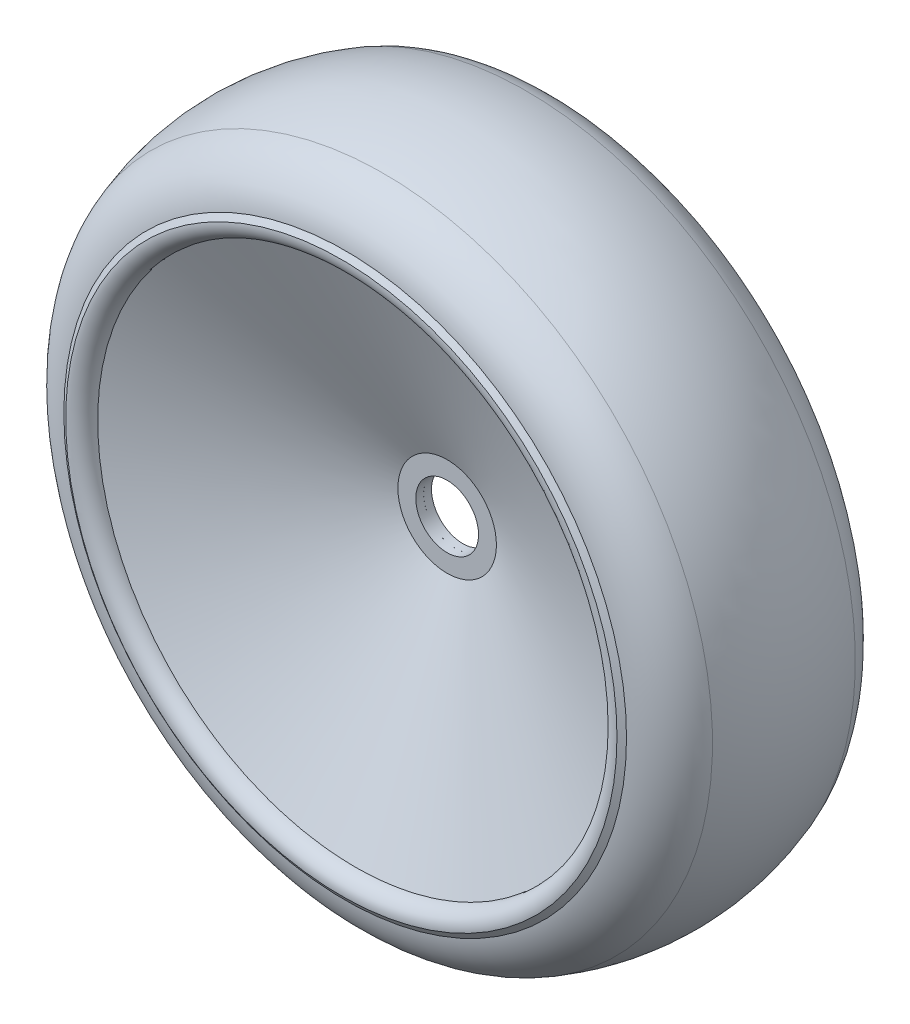
from build123d import *


# Read off the part's stored shape, not the designer's step: Revolve-Thin1
with BuildPart() as part:
    # Revolve-Thin1 outline → Revolve-Thin1 (revolve)
    with BuildSketch(Plane.XZ):
        with BuildLine():
            ThreePointArc((33, -11.775418724), (33.289529814, -13.747837508), (35.139711654, -14.490192231))
            Line((35.139711654, -14.490192231), (35.866025404, -14))
            ThreePointArc((35.866025404, -14), (35.5, -13.633974596), (35, -13.5))
            ThreePointArc((35, -13.5), (34.028238052, -13.064507966), (34, -12))
            Line((34, -12), (34, -2))
            ThreePointArc((34, -2), (33.414213562, -0.585786438), (32, 0))
            Line((32, 0), (4, 0))
            Line((4, 0), (4, -1))
            Line((4, -1), (32, -1))
            ThreePointArc((32, -1), (32.707106781, -1.292893219), (33, -2))
            Line((33, -2), (33, -11.775418724))
        make_face()
    revolve(axis=Axis((0, 0, 0), (0, 0, 1)))

    # Mirror4 2: part across plane


with BuildPart() as body_2:
    # Sketch10 → Revolve4 (revolve)
    with BuildSketch(Plane(origin=(0, 0, 0), x_dir=(0, 0, -1), z_dir=(1, 0, 0)), mode=Mode.PRIVATE) as revolve4_sk:
        with BuildLine():
            Line((0, 4), (0, 43.49165142))
            ThreePointArc((0, 43.49165142), (4.618406935, 43.098823056), (9.104122467, 41.931624312))
            ThreePointArc((9.104122467, 41.931624312), (12.411522036, 39.592542807), (14, 35.866025404))
            Line((14, 35.866025404), (0, 4))
        make_face()
    revolve(revolve4_sk.sketch.rotate(Axis((0, 0, -25.261416216), (0, 0, 1)), 90), axis=Axis((0, 0, -25.261416216), (0, 0, 1)))

    # Mirror4: body 2 across plane


with BuildPart() as body_2_1:
    add(body_2.part)
    add(body_2.part.mirror(Plane.XY))


with BuildPart() as part_1:
    add(part.part)
    add(part.part.mirror(Plane.XY))


solid = Compound([body_2_1.part, part_1.part])
